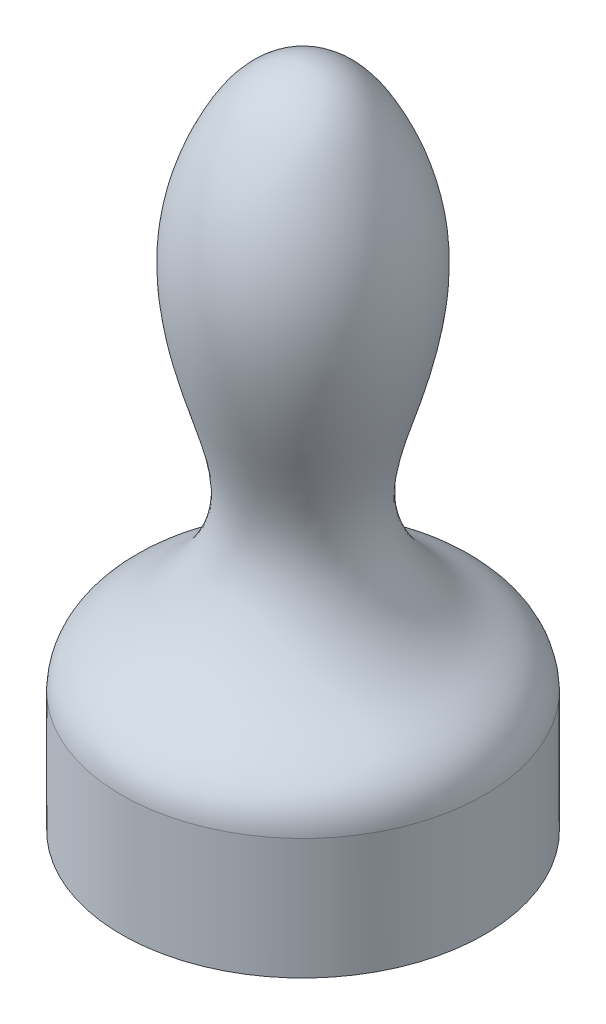
from build123d import *

# Parameters (mm, degrees)
ROSCA1_PITCH          = 1.5
CORTAR_EXTRUIR1_START = 10
CROQUIS3_R            = 15
CORTAR_EXTRUIR1_DEPTH = 10


with BuildPart() as part:
    # Croquis1 → Revolución1 (revolve)
    with BuildSketch(Plane.XY, mode=Mode.PRIVATE) as revoluci_n1_sk:
        with BuildLine():
            Line((-12, 0), (-12, 5))
            Line((-12, 5), (0, 5))
            Line((0, 5), (0, 55))
            add(Edge.make_bspline(
                [(0, 55), (-3.180764289, 54.869157284), (-6.802128833, 49.987752556), (-9.296892214, 41.327039564), (-7.460278375, 32.164910722), (-3.920844043, 22.793687376), (-9.40714477, 14.872769973), (-14.838813261, 12.976020169), (-15, 10)],
                knots=[0, 0, 0, 0, 0.153337628, 0.314153231, 0.514828567, 0.684692443, 0.859563088, 1, 1, 1, 1], degree=3))
            Line((-15, 10), (-15, 0))
            Line((-15, 0), (-12, 0))
        make_face()
    revolve(revoluci_n1_sk.sketch.rotate(Axis((0, 5, 0), (0, 1, 0)), 270), axis=Axis((0, 5, 0), (0, 1, 0)))

    # Rosca1: the profile of Perfil de rosca1 profile screwed along a right-hand helix of 4.333333 turns, 8 arcs to a turn; built about Z, then put on its axis
    rosca1_z = Axis((0, 0, 0), (0, 0, 1))
    rosca1_corners = [(12.0003, 0, -0.000173205), (12.0003, 0, 1.312673201), (11.188101187, 0, 0.843749998), (11.188101187, 0, 0.468749998)]
    with BuildLine(mode=Mode.PRIVATE) as rosca1_profile:
        Line(rosca1_corners[0], rosca1_corners[1])
        Line(rosca1_corners[1], rosca1_corners[2])
        Line(rosca1_corners[2], rosca1_corners[3])
        Line(rosca1_corners[3], rosca1_corners[0])
    rosca1_cap = Face(rosca1_profile.wire())
    rosca1_turn_angles = [0, 22.5, 45, 67.5, 90, 112.5, 135, 157.5, 180, 202.5, 225, 247.5, 270, 292.5, 315, 337.5, 360]
    rosca1_turn_weights = [1, 0.9238795325112867, 1, 0.9238795325112867, 1, 0.9238795325112867, 1, 0.9238795325112867, 1, 0.9238795325112867, 1, 0.9238795325112867, 1, 0.9238795325112867, 1, 0.9238795325112867, 1]
    rosca1_turn_rails = [Edge.make_bspline([Vector(p[0], p[1], 0).rotate(rosca1_z, rosca1_turn_angles[k]) / rosca1_turn_weights[k] + Vector(0, 0, p[2] + ROSCA1_PITCH * rosca1_turn_angles[k] / 360) for k in range(17)], [0, 0, 0, 1, 1, 2, 2, 3, 3, 4, 4, 5, 5, 6, 6, 7, 7, 8, 8, 8], 2, rosca1_turn_weights) for p in rosca1_corners]
    rosca1_turn_sides = [Face.make_surface_from_curves(rosca1_turn_rails[p[0]], rosca1_turn_rails[p[1]]) for p in [(0, 1), (1, 2), (2, 3), (3, 0)]]
    rosca1_last_angles = [1440, 1462.5, 1485, 1507.5, 1530, 1545, 1560]
    rosca1_last_weights = [1, 0.9238795325112867, 1, 0.9238795325112867, 1, 0.9659258262890683, 1]
    rosca1_last_rails = [Edge.make_bspline([Vector(p[0], p[1], 0).rotate(rosca1_z, rosca1_last_angles[k]) / rosca1_last_weights[k] + Vector(0, 0, p[2] + ROSCA1_PITCH * rosca1_last_angles[k] / 360) for k in range(7)], [0, 0, 0, 1, 1, 2, 2, 3, 3, 3], 2, rosca1_last_weights) for p in rosca1_corners]
    rosca1_last_sides = [Face.make_surface_from_curves(rosca1_last_rails[p[0]], rosca1_last_rails[p[1]]) for p in [(0, 1), (1, 2), (2, 3), (3, 0)]]
    rosca1 = Plane(origin=(0, -1.5, 0), x_dir=(1, 0, 0), z_dir=(0, 1, 0)) * Solid(Shell([*[p.moved(Location((0, 0, ROSCA1_PITCH * i))) for i in range(4) for p in rosca1_turn_sides], *rosca1_last_sides, rosca1_cap, rosca1_cap.rotate(rosca1_z, 1560).moved(Location((0, 0, ROSCA1_PITCH * 1560 / 360)))]))
    add(rosca1)

    # Croquis3 → Cortar-Extruir1 (cut)
    with BuildSketch(Plane.XZ.offset(CORTAR_EXTRUIR1_START)):
        with Locations(Location((0, 0, 0), (0, 0, 270))):
            Circle(CROQUIS3_R)
    extrude(amount=-CORTAR_EXTRUIR1_DEPTH, mode=Mode.SUBTRACT)


solid = part.part
